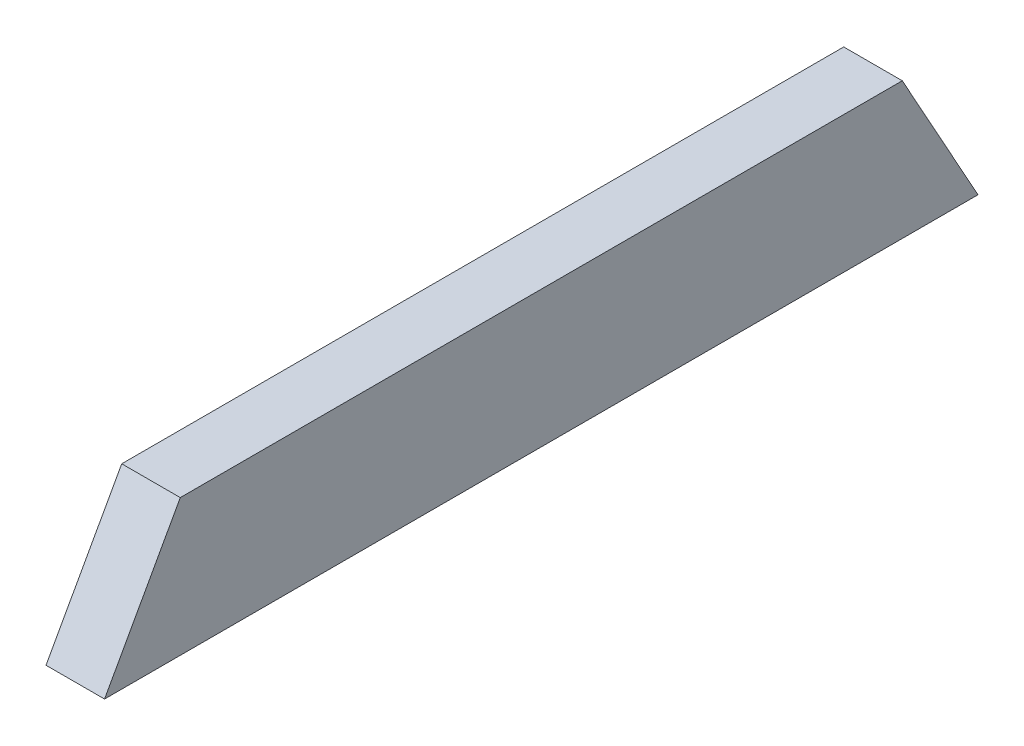
from build123d import *

# Parameters (mm, degrees)
SKETCH1_W           = 38.1
SKETCH1_H           = 88.9
BOSS_EXTRUDE1_DEPTH = 568.3885
CUT_EXTRUDE1_DEPTH  = 577.559022939


with BuildPart() as part:
    # Sketch1 → Boss-Extrude1 (new body)
    with BuildSketch(Plane.XY):
        with Locations((19.05, 44.45)):
            Rectangle(SKETCH1_W, SKETCH1_H)
    extrude(amount=BOSS_EXTRUDE1_DEPTH)

    # Sketch2 → Cut-Extrude1 (cut, through all)
    with BuildSketch(Plane(origin=(38.1, 0, 0), x_dir=(0, 0, -1), z_dir=(1, 0, 0))):
        Polygon((-519.110425326, 88.9), (-568.3885, 0), (-568.3885, 88.9), align=None)
        Polygon((-49.278074674, 88.9), (0, 0), (0, 88.9), align=None)
    extrude(amount=-CUT_EXTRUDE1_DEPTH, mode=Mode.SUBTRACT)


solid = part.part
